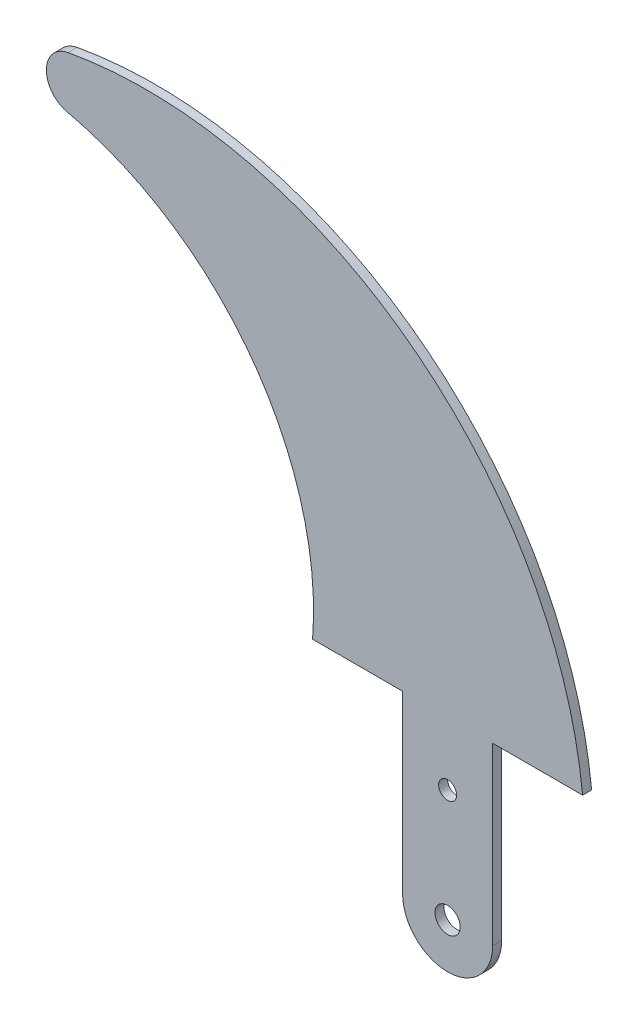
from build123d import *

# Parameters (mm, degrees)
MODEL_R           = 1.4
MODEL_R_2         = 1
BRIDA_BASE1_DEPTH = 1


# Sheet-metal steps are written as plain solids
with BuildPart() as part:
    # Model → Brida base1 (new body)
    with BuildSketch(Plane.XY):
        with BuildLine():
            Line((60.2059904, 3.7384384), (50.2059904, 3.7384384))
            Line((50.2059904, 3.7384384), (50.2059904, -15.7615616))
            ThreePointArc((50.2059904, -15.7615616), (45.2059904, -20.7615616), (40.2059904, -15.7615616))
            Line((40.2059904, -15.7615616), (40.2059904, 3.7384384))
            Line((40.2059904, 3.7384384), (30.2059904, 3.7384384))
            ThreePointArc((30.2059904, 3.7384384), (23.46215545, 27.372628124), (2.911625265, 40.853352987))
            ThreePointArc((2.911625265, 40.853352987), (0.630018379, 43.781083427), (3.040300155, 46.603826289))
            ThreePointArc((3.040300155, 46.603826289), (40.977818177, 37.646613371), (60.2059904, 3.7384384))
        make_face()
        with Locations((45.2059904, -15.7615616)):
            Circle(MODEL_R, mode=Mode.SUBTRACT)
        with Locations((45.2059904, -3.2615616)):
            Circle(MODEL_R_2, mode=Mode.SUBTRACT)
    extrude(amount=-BRIDA_BASE1_DEPTH)


solid = part.part
